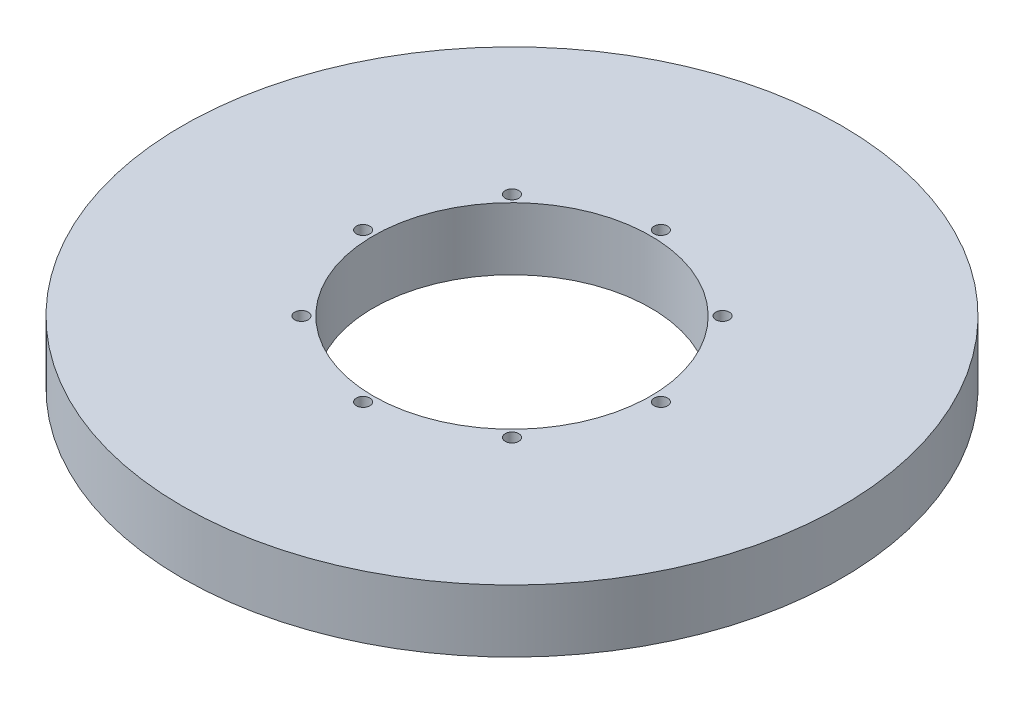
from build123d import *

# Parameters (mm, degrees)
SKETCH1_R           = 95
BOSS_EXTRUDE1_DEPTH = 18
SKETCH2_R           = 40
CUT_EXTRUDE1_DEPTH  = 136.550728512
SKETCH3_R           = 1.948869244
CUT_EXTRUDE2_DEPTH  = 12.471269505
CIRPATTERN1_COUNT   = 8


with BuildPart() as part:
    # Sketch1 → Boss-Extrude1 (new body)
    with BuildSketch(Plane(origin=(0, 0, 0), x_dir=(1, 0, 0), z_dir=(0, 1, 0))):
        Circle(SKETCH1_R)
    extrude(amount=BOSS_EXTRUDE1_DEPTH)

    # Sketch2 → Cut-Extrude1 (cut, through all)
    with BuildSketch(Plane(origin=(0, 0, 0), x_dir=(1, 0, 0), z_dir=(0, 1, 0))):
        Circle(SKETCH2_R)
    extrude(amount=CUT_EXTRUDE1_DEPTH, mode=Mode.SUBTRACT)

    # Sketch3 → Cut-Extrude2 (cut)
    with BuildSketch(Plane(origin=(0, 18, 0), x_dir=(1, 0, 0), z_dir=(0, 1, 0))):
        with Locations((-42.919700029, 0)):
            Circle(SKETCH3_R)
    cut_extrude2 = extrude(amount=-CUT_EXTRUDE2_DEPTH, mode=Mode.SUBTRACT)

    # CirPattern1: Cut-Extrude2 ×8 about axis
    cirpattern1_axis = Axis((0, 0, 0), (0, 1, 0))
    for i in range(1, CIRPATTERN1_COUNT):
        add(cut_extrude2.rotate(cirpattern1_axis, i * 360 / CIRPATTERN1_COUNT), mode=Mode.SUBTRACT)


solid = part.part
